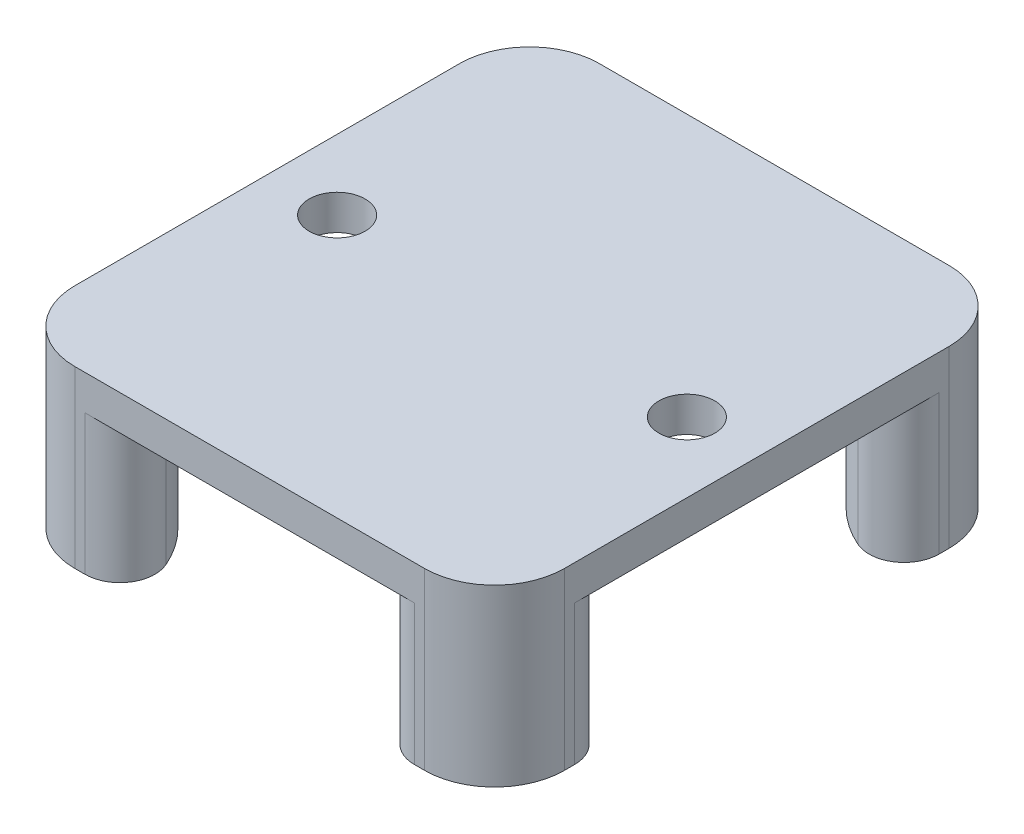
from build123d import *

# Parameters (mm, degrees)
SZKIC1_W                    = 28
SZKIC1_H                    = 30
SZKIC1_R                    = 1.6
DODANIE_WYCI_GNI_CIE1_DEPTH = 2
DODANIE_WYCI_GNI_CIE2_DEPTH = 8
ZAOKR_GLENIE1_R             = 4
ZAOKR_GLENIE2_R             = 2


with BuildPart() as part:
    # Szkic1 → Dodanie-wyciągnięcie1 (new body)
    with BuildSketch(Plane(origin=(0, 0, 0), x_dir=(1, 0, 0), z_dir=(0, 1, 0))):
        Rectangle(SZKIC1_W, SZKIC1_H)
        with Locations((10, 0)):
            Circle(SZKIC1_R, mode=Mode.SUBTRACT)
        with Locations((-10, 0)):
            Circle(SZKIC1_R, mode=Mode.SUBTRACT)
    extrude(amount=DODANIE_WYCI_GNI_CIE1_DEPTH)

    # Szkic2 → Dodanie-wyciągnięcie2 (add)
    with BuildSketch(Plane.XZ):
        with BuildLine():
            Line((-14, 8), (-14, 15))
            Line((-14, 15), (-7, 15))
            ThreePointArc((-7, 15), (-9.050252532, 10.050252532), (-14, 8))
        make_face()
        with BuildLine():
            Line((14, 8), (14, 15))
            Line((14, 15), (7, 15))
            ThreePointArc((7, 15), (9.050252532, 10.050252532), (14, 8))
        make_face()
        with BuildLine():
            Line((14, -15), (7, -15))
            ThreePointArc((7, -15), (9.050252532, -10.050252532), (14, -8))
            Line((14, -8), (14, -15))
        make_face()
        with BuildLine():
            Line((-14, -8), (-14, -15))
            Line((-14, -15), (-7, -15))
            ThreePointArc((-7, -15), (-9.050252532, -10.050252532), (-14, -8))
        make_face()
    extrude(amount=DODANIE_WYCI_GNI_CIE2_DEPTH)

    # Zaokrąglenie1
    zaokr_glenie1_edges = [part.edges().sort_by_distance(p)[0] for p in [
        (-14, -3, 15),
        (14, -3, 15),
        (14, -3, -15),
        (-14, -3, -15),
    ]]
    fillet(zaokr_glenie1_edges, radius=ZAOKR_GLENIE1_R)

    # Zaokrąglenie2
    zaokr_glenie2_edges = [part.edges().sort_by_distance(p)[0] for p in [
        (-14, -4, 8),
        (-7, -4, 15),
        (14, -4, 8),
        (7, -4, 15),
        (-14, -4, -8),
        (-7, -4, -15),
        (14, -4, -8),
        (7, -4, -15),
    ]]
    fillet(zaokr_glenie2_edges, radius=ZAOKR_GLENIE2_R)


solid = part.part
